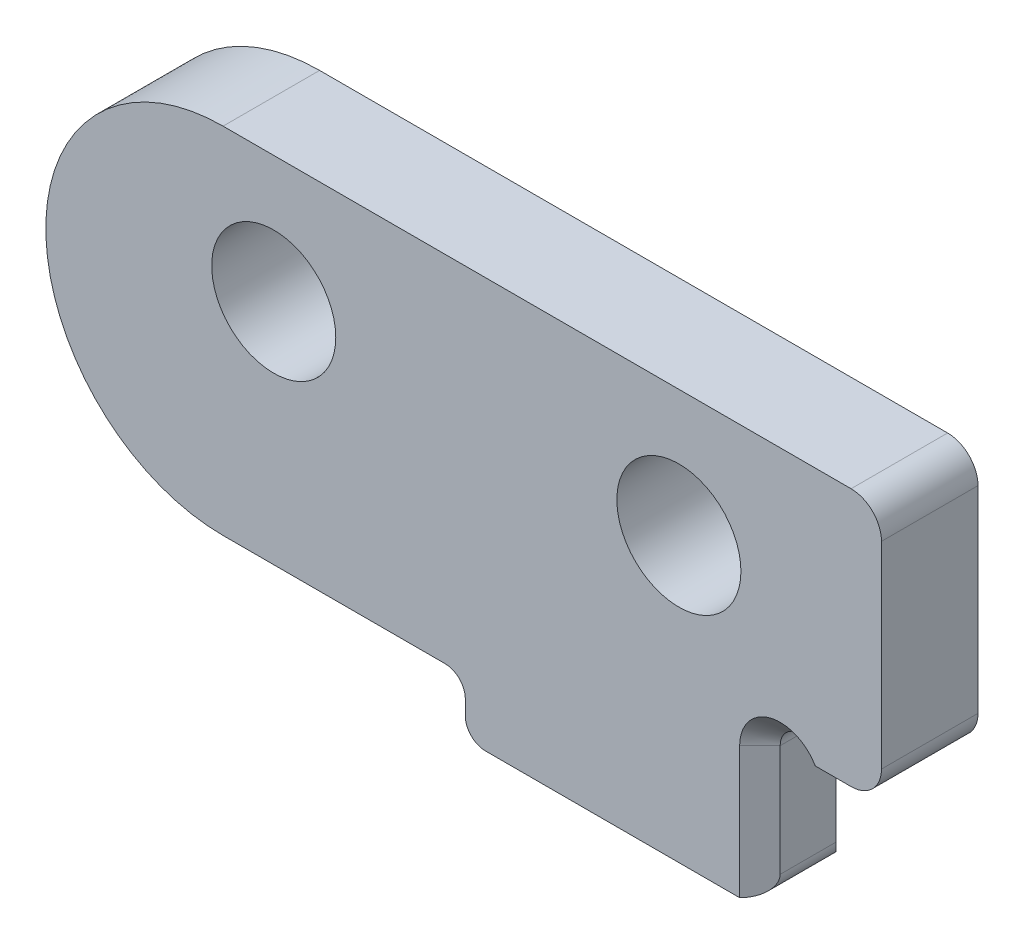
from build123d import *

# Parameters (mm, degrees)
CROQUIS1_R                       = 6.125
SALIENTE_EXTRUIR1_DEPTH          = 9.53
BRIDA_DE_ARISTA1_STRIP_W         = 57.18
BRIDA_DE_ARISTA1_STRIP_H         = 9.53
BRIDA_DE_ARISTA1_STRIP_CUT_DEPTH = 85
BRIDA_DE_ARISTA1_DEPTH           = 85
REDONDEO1_R                      = 10
CHAFL_N1_SIZE                    = 25
CHAFL_N1_SIZE2                   = 20
REDONDEO2_R                      = 20
CORTAR_EXTRUIR3_DEPTH            = 148.009594705
CORTAR_EXTRUIR3_DEPTH_BACK       = 148.009594705
CROQUIS7_W                       = 70
CROQUIS7_H                       = 50
CORTAR_EXTRUIR5_DEPTH            = 92.169188443
CORTAR_EXTRUIR5_DEPTH_BACK       = 92.169188443
CROQUIS8_W                       = 21.963248134
CROQUIS8_H                       = 19.06
CORTAR_EXTRUIR6_REACH            = 68.882
CROQUIS10_W                      = 12
CROQUIS10_H                      = 15
SALIENTE_EXTRUIR3_START          = -9.53
SALIENTE_EXTRUIR3_DEPTH          = 9.53
REDONDEO3_R                      = 3
REDONDEO4_R                      = 2
CHAFL_N2_SIZE                    = 2


# Sheet-metal steps are written as plain solids
with BuildPart() as part:
    # Croquis1 → Saliente-Extruir1 (new body)
    with BuildSketch(Plane.XY):
        with BuildLine():
            Line((-5, 12.5), (59.758688568, 12.5))
            ThreePointArc((59.758688568, 12.5), (63.068757982, 11.936283192), (66.005639043, 10.308688094))
            Line((66.005639043, 10.308688094), (70.527359279, 6.691311906))
            ThreePointArc((70.527359279, 6.691311906), (73.464240341, 5.063716808), (76.774309755, 4.5))
            Line((76.774309755, 4.5), (123.266499161, 4.5))
            ThreePointArc((123.266499161, 4.5), (125.848488059, 3.781744193), (127.688665549, 1.833333333))
            ThreePointArc((127.688665549, 1.833333333), (129.41356885, -2.692366017), (130, -7.5))
            Line((130, -7.5), (130, -37.5))
            Line((130, -37.5), (45, -37.5))
            Line((45, -37.5), (45, -22.5))
            Line((45, -22.5), (-5, -22.5))
            ThreePointArc((-5, -22.5), (-22.5, -5), (-5, 12.5))
        make_face()
        Circle(CROQUIS1_R, mode=Mode.SUBTRACT)
        with Locations((40, 0)):
            Circle(CROQUIS1_R, mode=Mode.SUBTRACT)
    extrude(amount=SALIENTE_EXTRUIR1_DEPTH)

    # Brida de arista1 strip (across the edge) → Brida de arista1 strip cut (cut)
    with BuildSketch(Plane(origin=(45, -37.5, 9.53), x_dir=(0, 1, 0), z_dir=(1, 0, 0))):
        with Locations((-19.06, -4.765)):
            Rectangle(BRIDA_DE_ARISTA1_STRIP_W, BRIDA_DE_ARISTA1_STRIP_H)
    extrude(amount=BRIDA_DE_ARISTA1_STRIP_CUT_DEPTH, mode=Mode.SUBTRACT)

    # Brida de arista1 section (across the edge) → Brida de arista1 (add)
    with BuildSketch(Plane(origin=(45, -37.5, 9.53), x_dir=(0, 1, 0), z_dir=(1, 0, 0))):
        with BuildLine():
            Line((-9.53, 9.53), (-9.53, 40.47))
            Line((-9.53, 40.47), (0, 40.47))
            Line((0, 40.47), (0, 9.53))
            ThreePointArc((0, 9.53), (2.791272375, 2.791272375), (9.53, 0))
            Line((9.53, 0), (9.53, -9.53))
            ThreePointArc((9.53, -9.53), (-3.947455249, -3.947455249), (-9.53, 9.53))
        make_face()
    extrude(amount=BRIDA_DE_ARISTA1_DEPTH)

    # Redondeo1
    redondeo1_edges = [part.edges().sort_by_distance(p)[0] for p in [
        (45, -22.5, 4.765),
        (45, -42.265, 50),
    ]]
    fillet(redondeo1_edges, radius=REDONDEO1_R)

    # Chaflán1
    chafl_n1_edges = [part.edges().sort_by_distance(p)[0] for p in [
        (130, -42.265, 50),
    ]]
    chafl_n1_side = [part.faces().sort_by_distance(p)[0] for p in [
        (130, -17.735, 0.637386923),
    ]]
    chamfer(chafl_n1_edges, length=CHAFL_N1_SIZE, length2=CHAFL_N1_SIZE2, reference=chafl_n1_side[0])

    # Redondeo2
    redondeo2_edges = [part.edges().sort_by_distance(p)[0] for p in [
        (110, -42.265, 50),
        (130, -42.265, 25),
    ]]
    fillet(redondeo2_edges, radius=REDONDEO2_R)

    # Croquis7 → Cortar-Extruir3 (cut, two sides: drawn at the far end of the back side and taken through both)
    with BuildSketch(Plane(origin=(0, 0, 0), x_dir=(1, 0, 0), z_dir=(0, 1, 0)).offset(-CORTAR_EXTRUIR3_DEPTH_BACK)):
        with Locations((95, -25)):
            Rectangle(CROQUIS7_W, CROQUIS7_H)
    extrude(amount=CORTAR_EXTRUIR3_DEPTH + CORTAR_EXTRUIR3_DEPTH_BACK, mode=Mode.SUBTRACT)

    # Croquis8 → Cortar-Extruir5 (cut, two sides: drawn at the far end of the back side and taken through both)
    with BuildSketch(Plane.XY.offset(-CORTAR_EXTRUIR5_DEPTH_BACK)):
        with Locations((49.018375933, -37.5)):
            Rectangle(CROQUIS8_W, CROQUIS8_H)
    extrude(amount=CORTAR_EXTRUIR5_DEPTH + CORTAR_EXTRUIR5_DEPTH_BACK, mode=Mode.SUBTRACT)

    # Croquis10 → Cortar-Extruir6 (cut, up to next)
    with BuildSketch(Plane(origin=(0, 0, 0), x_dir=(-1, 0, 0), z_dir=(0, 0, -1)), mode=Mode.PRIVATE) as cortar_extruir6_sk1:
        with Locations((-54, -20.47)):
            Rectangle(CROQUIS10_W, CROQUIS10_H)
    cortar_extruir6_tool1 = extrude(cortar_extruir6_sk1.sketch, amount=-CORTAR_EXTRUIR6_REACH, mode=Mode.PRIVATE) & part.part
    add(cortar_extruir6_tool1.solids().sort_by_distance((54, -20.47, 0))[0], mode=Mode.SUBTRACT)

    # Croquis9 → Saliente-Extruir3 (add)
    with BuildSketch(Plane(origin=(0, 0, 0), x_dir=(-1, 0, 0), z_dir=(0, 0, -1)).offset(SALIENTE_EXTRUIR3_START)):
        with BuildLine():
            Line((-18.915105159, -22.5), (-35, -22.5))
            ThreePointArc((-35, -22.5), (-40.229722746, -23.976503065), (-43.915105159, -27.97))
            Line((-43.915105159, -27.97), (-18.915105159, -27.97))
            Line((-18.915105159, -27.97), (-18.915105159, -22.5))
        make_face()
    extrude(amount=SALIENTE_EXTRUIR3_DEPTH)

    # Redondeo3
    redondeo3_edges = [part.edges().sort_by_distance(p)[0] for p in [
        (60, -12.97, 4.765),
        (60, 12.497088016, 4.765),
    ]]
    fillet(redondeo3_edges, radius=REDONDEO3_R)

    # Redondeo4
    redondeo4_edges = [part.edges().sort_by_distance(p)[0] for p in [
        (48, -12.97, 4.765),
        (48, -27.97, 4.765),
        (18.915105159, -27.97, 4.765),
        (18.915105159, -22.5, 4.765),
    ]]
    fillet(redondeo4_edges, radius=REDONDEO4_R)

    # Chaflán2
    # the kernel refuses this chamfer: 2 mm, written as the material it takes off along each edge
    with BuildSketch(Plane(origin=(48, -31.113365976, 0), x_dir=(0.02749587661058563, 0, 0.9996219169112968), z_dir=(0, 1, 0))) as chafl_n2_piece_1:
        Polygon((CHAFL_N2_SIZE * 0.999621916911, -CHAFL_N2_SIZE * 0.0274958766106), (-CHAFL_N2_SIZE * 0.0274958766106, -CHAFL_N2_SIZE * 0.999621916911), (0, 0), align=None)
    extrude(amount=16.143365976, mode=Mode.SUBTRACT)
    with BuildSketch(Plane(origin=(48, -14.97, 9.53), x_dir=(-0.9996219169112968, 0, 0.02749587661058651), z_dir=(0, -1, 0))) as chafl_n2_piece_2:
        Polygon((CHAFL_N2_SIZE * 0.999621916911, CHAFL_N2_SIZE * 0.0274958766106), (-CHAFL_N2_SIZE * 0.0274958766106, CHAFL_N2_SIZE * 0.999621916911), (0, 0), align=None)
    extrude(amount=16.143365976, mode=Mode.SUBTRACT)
    with BuildSketch(Plane(origin=(50, -14.97, 0), x_dir=(0.5386859165215014, -0.8425066666450718, 0), z_dir=(-0.8425066666450718, -0.5386859165215014, 0))) as chafl_n2_piece_3:
        Polygon((2, CHAFL_N2_SIZE), (2 + CHAFL_N2_SIZE, 0), (2, 0), align=None)
    revolve(axis=Axis((50, -14.97, 0), (0, 0, 1)), revolution_arc=237.405771779, mode=Mode.SUBTRACT)
    with BuildSketch(Plane(origin=(50, -14.97, 9.53), x_dir=(0.5386859165215014, -0.8425066666450718, 0), z_dir=(-0.8425066666450718, -0.5386859165215014, 0))) as chafl_n2_piece_4:
        Polygon((2 + CHAFL_N2_SIZE, 0), (2, -CHAFL_N2_SIZE), (2, 0), align=None)
    revolve(axis=Axis((50, -14.97, 9.53), (0, 0, 1)), revolution_arc=237.405771779, mode=Mode.SUBTRACT)


solid = part.part
